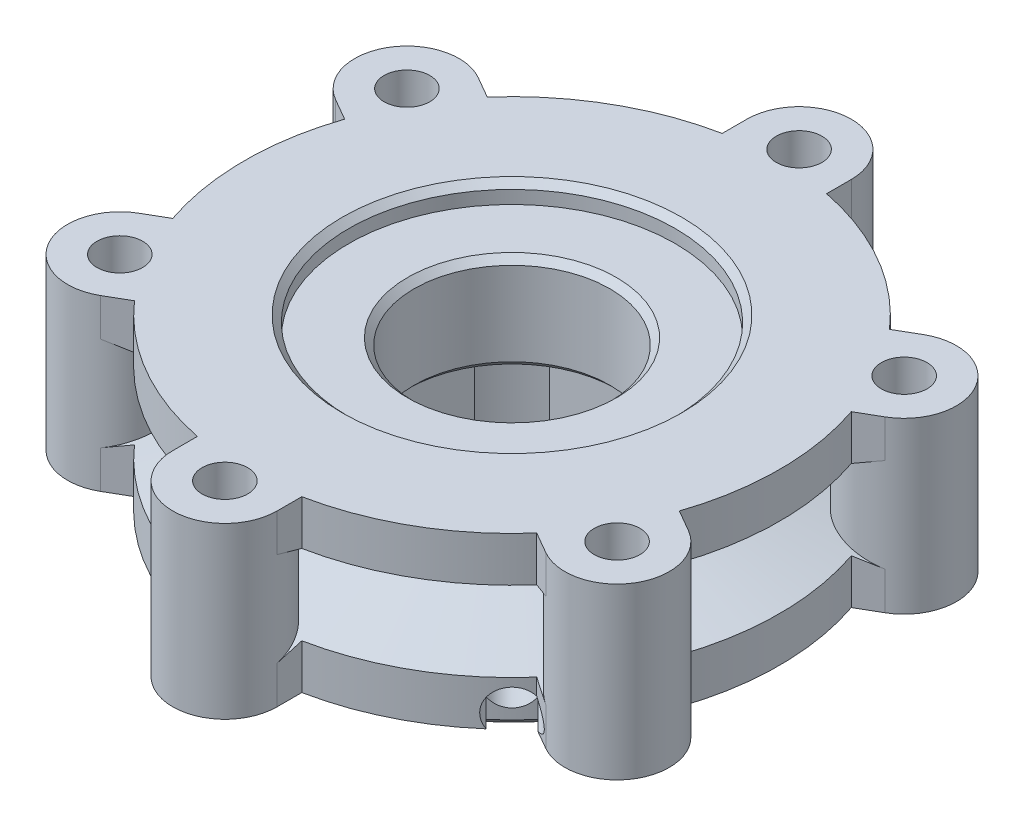
from build123d import *
from build123d.topology import SkipClean

# Parameters (mm, degrees)
SKETCH1_R            = 38.1
BOSS_EXTRUDE1_DEPTH  = 8.255
CUT_EXTRUDE4_DEPTH   = 0.635
CIRPATTERN2_COUNT    = 25
BOSS_EXTRUDE2_REACH  = 54.93
SKETCH5_R            = 5.08
SKETCH5_R_2          = 2.2225
BOSS_EXTRUDE6_REACH  = 54.93
SKETCH12_R           = 5.08
SKETCH17_R           = 2.2225
CUT_EXTRUDE5_DEPTH   = 51.962459117
CIRPATTERN1_COUNT    = 3
BOSS_EXTRUDE9_REACH  = 49.117
SKETCH18_R           = 16.51
FILLET5_R            = 1.27
SKETCH22_R           = 22.225
BOSS_EXTRUDE12_DEPTH = 2.54
CUT_EXTRUDE6_DEPTH   = 7.747
SKETCH24_R           = 9.525
CUT_EXTRUDE7_DEPTH   = 46.554432294
SKETCH25_R           = 15.875
CUT_EXTRUDE8_DEPTH   = 1.905
SKETCH33_R           = 2.2225
CUT_EXTRUDE9_DEPTH   = 46.431052325
SKETCH34_R           = 2.2225
CUT_EXTRUDE10_DEPTH  = 46.431052349
CHAMFER5_SIZE        = 0.635


with BuildPart() as part:
    # Sketch1 → Boss-Extrude1 (new, symmetric)
    with BuildSketch(Plane(origin=(0, 0, 0), x_dir=(1, 0, 0), z_dir=(0, 1, 0))):
        with Locations(Location((0, 0, 0), (0, 0, 270))):
            Circle(SKETCH1_R)
    extrude(amount=BOSS_EXTRUDE1_DEPTH, both=True)

    # Sketch9 → Cut-Extrude4 (cut)
    with BuildSketch(Plane.ZY.offset(38.1)):
        Polygon((-0.635, -8.255), (0.635, -8.255), (0.635, 0), (0.635, 8.255), (-0.635, 8.255), (-0.635, 0), align=None)
    cut_extrude4 = extrude(amount=-CUT_EXTRUDE4_DEPTH, mode=Mode.SUBTRACT)

    # CirPattern2: Cut-Extrude4 ×25 about axis
    cirpattern2_axis = Axis((0, 0, 0), (0, 1, 0))
    for i in range(1, CIRPATTERN2_COUNT):
        add(cut_extrude4.rotate(cirpattern2_axis, i * 360 / CIRPATTERN2_COUNT), mode=Mode.SUBTRACT)

    # Sketch4 → Cut-Revolve2 (revolve, cut)
    with BuildSketch(Plane.XY, mode=Mode.PRIVATE) as cut_revolve2_sk:
        Polygon((-38.1, -8.255), (-35.56, -8.255), (-35.56, -6.6675), (-12.7, 0), (-35.56, 6.6675), (-35.56, 8.255), (-38.1, 8.255), align=None)
    revolve(cut_revolve2_sk.sketch.rotate(Axis((0, -8.73125, 0), (0, 1, 0)), 270), axis=Axis((0, -8.73125, 0), (0, 1, 0)), mode=Mode.SUBTRACT)

    # Sketch5 → Boss-Extrude2 (add, up to next)
    with BuildSketch(Plane(origin=(0, 8.255, 0), x_dir=(1, 0, 0), z_dir=(0, 1, 0)), mode=Mode.PRIVATE) as boss_extrude2_sk1:
        with Locations(Location((0, 27.94, 0), (0, 0, 270))):
            Circle(SKETCH5_R)
        with Locations(Location((0, 27.94, 0), (0, 0, 138.663590039))):
            Circle(SKETCH5_R_2, mode=Mode.SUBTRACT)
    boss_extrude2_tool1 = extrude(boss_extrude2_sk1.sketch, amount=-BOSS_EXTRUDE2_REACH, mode=Mode.PRIVATE) - part.part
    boss_extrude2 = boss_extrude2_tool1.solids().sort_by_distance((0, 8.255, -32.876316))[0]
    add(boss_extrude2)

    # Sketch12 → Boss-Extrude6 (add, up to next)
    with BuildSketch(Plane(origin=(0, 8.255, 0), x_dir=(1, 0, 0), z_dir=(0, 1, 0)), mode=Mode.PRIVATE) as boss_extrude6_sk1:
        with Locations(Location((-24.196749782, 13.97, 0), (0, 0, 134.369268137))):
            Circle(SKETCH12_R)
    boss_extrude6_tool1 = extrude(boss_extrude6_sk1.sketch, amount=-BOSS_EXTRUDE6_REACH, mode=Mode.PRIVATE) - part.part
    boss_extrude6 = boss_extrude6_tool1.solids().sort_by_distance((-24.19675, 8.255, -13.97))[0]
    add(boss_extrude6)

    # Sketch17 → Cut-Extrude5 (cut, symmetric)
    with SkipClean():  # the faces are left unmerged after this step: merging them gives an invalid solid
        with BuildSketch(Plane(origin=(0, 0, 0), x_dir=(1, 0, 0), z_dir=(0, 1, 0))):
            with Locations(Location((0, 27.94, 0), (0, 0, 270))):
                Circle(SKETCH17_R)
            with Locations(Location((-24.196749782, 13.97, 0), (0, 0, 270))):
                Circle(SKETCH17_R)
            with Locations(Location((-24.196749782, -13.97, 0), (0, 0, 270))):
                Circle(SKETCH17_R)
            with BuildLine():
                Line((-28.596158833, -16.51), (-30.795863359, -17.78))
                ThreePointArc((-30.795863359, -17.78), (-30.795863359, 17.78), (0, 35.56))
                Line((0, 35.56), (0, 33.02))
                ThreePointArc((0, 33.02), (-3.592102448, 31.532102448), (-5.08, 27.94))
                Line((-5.08, 27.94), (-5.08, 25.534580964))
                ThreePointArc((-5.08, 25.534580964), (-13.0175, 22.546971388), (-19.57359579, 17.166699533))
                Line((-19.57359579, 17.166699533), (-21.656749782, 18.369409051))
                ThreePointArc((-21.656749782, 18.369409051), (-28.596158833, 16.51), (-26.736749782, 9.570590949))
                Line((-26.736749782, 9.570590949), (-24.65359579, 8.367881431))
                ThreePointArc((-24.65359579, 8.367881431), (-26.035, 0), (-24.65359579, -8.367881431))
                Line((-24.65359579, -8.367881431), (-26.736749782, -9.570590949))
                ThreePointArc((-26.736749782, -9.570590949), (-29.103652979, -12.655199251), (-28.596158833, -16.51))
            make_face()
        cut_extrude5 = extrude(amount=CUT_EXTRUDE5_DEPTH, both=True, mode=Mode.SUBTRACT)

    # CirPattern1: Boss-Extrude2, Boss-Extrude6, Cut-Extrude5 ×3 about axis
    with SkipClean():  # the faces are left unmerged after this step: merging them gives an invalid solid
        cirpattern1_axis = Axis((0, 0, 0), (0, 1, 0))
        add([boss_extrude2.rotate(cirpattern1_axis, i * 360 / CIRPATTERN1_COUNT) for i in range(1, CIRPATTERN1_COUNT)])
        add([boss_extrude6.rotate(cirpattern1_axis, i * 360 / CIRPATTERN1_COUNT) for i in range(1, CIRPATTERN1_COUNT)])
        add([cut_extrude5.rotate(cirpattern1_axis, i * 360 / CIRPATTERN1_COUNT) for i in range(1, CIRPATTERN1_COUNT)], mode=Mode.SUBTRACT)

    # Sketch18 → Boss-Extrude9 (add, up to next)
    with BuildSketch(Plane.XZ.offset(8.255), mode=Mode.PRIVATE) as boss_extrude9_sk1:
        with Locations(Location((0, 0, 0), (0, 0, 270))):
            Circle(SKETCH18_R)
    boss_extrude9_tool1 = extrude(boss_extrude9_sk1.sketch, amount=-BOSS_EXTRUDE9_REACH, mode=Mode.PRIVATE) - part.part
    add(boss_extrude9_tool1.solids().sort_by_distance((0, -8.255, 0))[0])

    # Fillet5
    fillet5_edges = [part.edges().sort_by_distance(p)[0] for p in [
        (0, 1.11125, 16.51),
        (0, -1.11125, 16.51),
    ]]
    fillet(fillet5_edges, radius=FILLET5_R)

    # Sketch22 → Boss-Extrude12 (add)
    with SkipClean():  # the faces are left unmerged after this step: merging them gives an invalid solid
        with BuildSketch(Plane.XZ.offset(8.255)):
            with Locations(Location((0, 0, 0), (0, 0, 90))):
                Circle(SKETCH22_R)
        extrude(amount=BOSS_EXTRUDE12_DEPTH)

    # Sketch23 → Cut-Extrude6 (cut)
    with SkipClean():  # the faces are left unmerged after this step: merging them gives an invalid solid
        with BuildSketch(Plane.XZ.offset(10.795)):
            with BuildLine():
                Line((1.44e-07, -10.160001922), (-6.506811855, -10.160001922))
                ThreePointArc((-6.506811855, -10.160001922), (-8.531241454, -8.531245257), (-10.159998118, -6.506815658))
                Line((-10.159998118, -6.506815658), (-10.159998118, 6.506811815))
                ThreePointArc((-10.159998118, 6.506811815), (-8.531241454, 8.531241413), (-6.506811855, 10.159998078))
                Line((-6.506811855, 10.159998078), (1.44e-07, 10.159998078))
                Line((1.44e-07, 10.159998078), (6.506815618, 10.159998078))
                ThreePointArc((6.506815618, 10.159998078), (8.531245177, 8.531241373), (10.160001882, 6.506811815))
                Line((10.160001882, 6.506811815), (10.160001882, -6.506815658))
                ThreePointArc((10.160001882, -6.506815658), (8.531245177, -8.531245217), (6.506815618, -10.160001922))
                Line((6.506815618, -10.160001922), (1.44e-07, -10.160001922))
            make_face()
        extrude(amount=-CUT_EXTRUDE6_DEPTH, mode=Mode.SUBTRACT)

    # Sketch24 → Cut-Extrude7 (cut, through all)
    with SkipClean():  # the faces are left unmerged after this step: merging them gives an invalid solid
        with BuildSketch(Plane.XZ.offset(3.048)):
            with Locations(Location((0, 0, 0), (0, 0, 270))):
                Circle(SKETCH24_R)
        extrude(amount=-CUT_EXTRUDE7_DEPTH, mode=Mode.SUBTRACT)

    # Sketch25 → Cut-Extrude8 (cut)
    with SkipClean():  # the faces are left unmerged after this step: merging them gives an invalid solid
        with BuildSketch(Plane(origin=(0, 8.255, 0), x_dir=(1, 0, 0), z_dir=(0, 1, 0))):
            with Locations(Location((0, 0, 0), (0, 0, 270))):
                Circle(SKETCH25_R)
        extrude(amount=-CUT_EXTRUDE8_DEPTH, mode=Mode.SUBTRACT)

    # Sketch33 → Cut-Extrude9 (cut, through all)
    with SkipClean():  # the faces are left unmerged after this step: merging them gives an invalid solid
        with BuildSketch(Plane(origin=(0, 0, 0), x_dir=(-0.7071067811865626, 1.5636783920886447e-07, -0.7071067811865154), z_dir=(0.7071067811865296, 2.491399527700296e-07, -0.7071067811865217))):
            with Locations(Location((0, -6.92149666, 0), (0, 0, 179.999991041))):
                Circle(SKETCH33_R)
        extrude(amount=CUT_EXTRUDE9_DEPTH, mode=Mode.SUBTRACT)

    # Sketch34 → Cut-Extrude10 (cut, through all)
    with SkipClean():  # the faces are left unmerged after this step: merging them gives an invalid solid
        with BuildSketch(Plane(origin=(0, 0, 0), x_dir=(0.7071067811865437, -2.212675127529558e-09, -0.7071067811865515), z_dir=(0.7071067811865515, -2.6320836188750305e-09, 0.7071067811865437))):
            with Locations(Location((2.696e-06, -6.921500037, 0), (0, 0, 180.000000127))):
                Circle(SKETCH34_R)
        extrude(amount=CUT_EXTRUDE10_DEPTH, mode=Mode.SUBTRACT)

    # Chamfer5
    chamfer5_edges = [part.edges().sort_by_distance(p)[0] for p in [
        (0, -10.795, -22.225),
        (-8.531241454, -10.795, -8.531245257),
        (1.882e-06, -10.795, -10.160001922),
        (8.531245177, -10.795, -8.531245217),
        (10.160001882, -10.795, -1.922e-06),
        (8.531245177, -10.795, 8.531241373),
        (1.882e-06, -10.795, 10.159998078),
        (-8.531241454, -10.795, 8.531241413),
        (-10.159998118, -10.795, -1.922e-06),
        (0, -3.048, 9.525),
        (0, 6.35, 9.525),
        (0, 8.255, -15.875),
    ]]
    chamfer(chamfer5_edges, length=CHAMFER5_SIZE - 0.0001)  # a hair under: the kernel refuses the full size


solid = part.part
